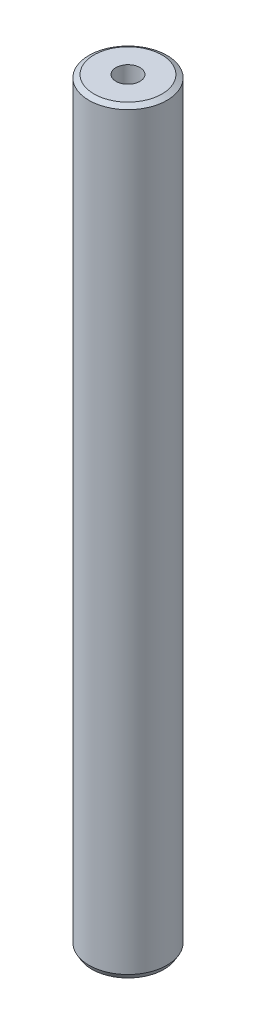
from build123d import *
from OCP.BRepFilletAPI import BRepFilletAPI_MakeChamfer

# Parameters (mm, degrees)
SKETCH1_R           = 20
BOSS_EXTRUDE1_DEPTH = 388.158257928
SKETCH2_R           = 6.150503184
CUT_EXTRUDE1_DEPTH  = 390.187401129
CHAMFER1_SIZE       = 1.505561055
CHAMFER1_SIZE2      = 2.607708241


with BuildPart() as part:
    # Sketch1 → Boss-Extrude1 (new body)
    with BuildSketch(Plane(origin=(0, 0, 0), x_dir=(1, 0, 0), z_dir=(0, 1, 0))):
        Circle(SKETCH1_R)
    extrude(amount=BOSS_EXTRUDE1_DEPTH)

    # Sketch2 → Cut-Extrude1 (cut, through all)
    with BuildSketch(Plane(origin=(0, 0, 0), x_dir=(1, 0, 0), z_dir=(0, 1, 0))):
        Circle(SKETCH2_R)
    extrude(amount=CUT_EXTRUDE1_DEPTH, mode=Mode.SUBTRACT)

    # Chamfer1: one chamfer whose edges measure the first distance from different faces: ONE call of the kernel's chamfer builder (chamfer() names one face for all edges)
    chamfer1_edges_1 = [part.edges().sort_by_distance(p)[0] for p in [
        (-20, 388.158257928, 0),
    ]]
    chamfer1_side_1 = [part.faces().sort_by_distance(p)[0] for p in [
        (-20, 194.079128964, 0),
    ]]
    chamfer1_edges_2 = [part.edges().sort_by_distance(p)[0] for p in [
        (-20, 0, 0),
    ]]
    chamfer1_side_2 = [part.faces().sort_by_distance(p)[0] for p in [
        (-19.434314575, 0, 0),
    ]]
    chamfer1 = BRepFilletAPI_MakeChamfer(part.part.solid().wrapped)
    for e in chamfer1_edges_1:
        chamfer1.Add(CHAMFER1_SIZE, CHAMFER1_SIZE2, e.wrapped, chamfer1_side_1[0].wrapped)  # the first distance lies on this face
    for e in chamfer1_edges_2:
        chamfer1.Add(CHAMFER1_SIZE, CHAMFER1_SIZE2, e.wrapped, chamfer1_side_2[0].wrapped)  # the first distance lies on this face
    add(Compound.cast(chamfer1.Shape()), mode=Mode.REPLACE)


solid = part.part
